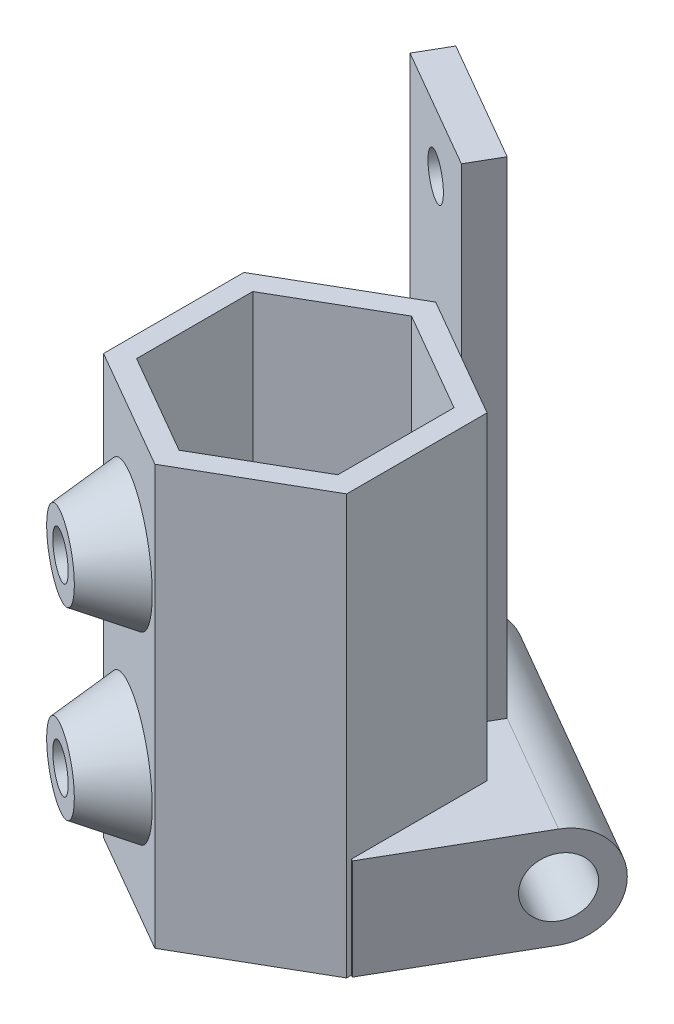
from build123d import *

# Parameters (mm, degrees)
RESSALTO_EXTRUS_O1_DEPTH      = 25
ESBO_O3_R                     = 2.25
RESSALTO_EXTRUS_O2_DEPTH      = 3
ESBO_O6_R                     = 1.25
CORTE_EXTRUS_O2_DEPTH         = 10
RESSALTO_EXTRUS_O3_DEPTH      = 5
RESSALTO_EXTRUS_O3_DEPTH_BACK = 7
ESBO_O8_W                     = 16.743157806
ESBO_O8_H                     = 6
CORTE_EXTRUS_O1_DEPTH         = 32.980788504
FILETE2_R                     = 3
ESBO_O10_R                    = 1.75
CORTE_EXTRUS_O3_DEPTH         = 36.379050234
RESSALTO_EXTRUS_O4_DEPTH      = 29
ESBO_O12_R                    = 1.25
CORTE_EXTRUS_O4_DEPTH         = 41.103846452


with BuildPart() as part:
    # Esboço1 → Ressalto-extrusão1 (new body)
    with BuildSketch(Plane(origin=(0, 0, 0), x_dir=(1, 0, 0), z_dir=(0, 1, 0))):
        Polygon((7.25, 4.185789452), (0, 8.371578903), (-7.25, 4.185789452), (-7.25, -4.185789452), (0, -8.371578903), (7.25, -4.185789452), align=None)
    extrude(amount=RESSALTO_EXTRUS_O1_DEPTH)

    # Esboço3 → Ressalto-extrusão2 (add)
    with BuildSketch(Plane(origin=(-3.625, 0, 6.278684177), x_dir=(0.8660254037844387, 0, 0.4999999999999999), z_dir=(-0.49999999999999994, 0, 0.8660254037844388))):
        with Locations(Location((0, 7, 0), (0, 0, 180))):
            Circle(ESBO_O3_R)
        with Locations(Location((0, 18, 0), (0, 0, 180))):
            Circle(ESBO_O3_R)
    extrude(amount=RESSALTO_EXTRUS_O2_DEPTH)

    # Esboço4 → Revolução1 (revolve)
    with BuildSketch(Plane(origin=(0, 18, 0), x_dir=(1, 0, 0), z_dir=(0, 1, 0))):
        Polygon((-7.073557159, -7.751760389), (-6.872595264, -4.403684177), (-5.573557159, -5.153684177), align=None)
    revolve(axis=Axis((-2.565266445, 18, 4.443171818), (-0.5000000000000001, 0, 0.8660254037844386)))

    # Esboço5 → Revolução2 (revolve)
    with BuildSketch(Plane(origin=(0, 7, 0), x_dir=(-1, 0, 0), z_dir=(0, -1, 0)), mode=Mode.PRIVATE) as revolu_o2_sk:
        Polygon((7.073557159, -7.751760389), (5.573557159, -5.153684177), (6.872595264, -4.403684177), align=None)
    revolve(revolu_o2_sk.sketch.rotate(Axis((-5.573557159, 7, 9.653684177), (0.4999999999999998, 0, -0.8660254037844388)), 180), axis=Axis((-5.573557159, 7, 9.653684177), (0.4999999999999998, 0, -0.8660254037844388)))

    # Esboço6 → Corte-extrusão2 (cut)
    with BuildSketch(Plane(origin=(-5.125, 0, 8.876760389), x_dir=(0.8660254037844386, 0, 0.5), z_dir=(-0.5000000000000001, 0, 0.8660254037844387))):
        with Locations((0, 18)):
            Circle(ESBO_O6_R)
        with Locations(Location((0, 7, 0), (0, 0, 180))):
            Circle(ESBO_O6_R)
    extrude(amount=-CORTE_EXTRUS_O2_DEPTH, mode=Mode.SUBTRACT)

    # Esboço8 → Ressalto-extrusão3 (add, two sides: drawn at the far end of the back side and taken through both)
    with BuildSketch(Plane(origin=(3.625, 0, -6.278684177), x_dir=(-0.8660254037844386, 0, -0.4999999999999999), z_dir=(0.49999999999999994, 0, -0.8660254037844387)).offset(-RESSALTO_EXTRUS_O3_DEPTH_BACK)):
        with Locations((0, 3)):
            Rectangle(ESBO_O8_W, ESBO_O8_H)
    extrude(amount=RESSALTO_EXTRUS_O3_DEPTH + RESSALTO_EXTRUS_O3_DEPTH_BACK)

    # Esboço2 → Corte-extrusão1 (cut, through all)
    with BuildSketch(Plane(origin=(0, 25, 0), x_dir=(1, 0, 0), z_dir=(0, 1, 0))):
        Polygon((0, 6.92820323), (-6, 3.464101615), (-6, -3.464101615), (0, -6.92820323), (6, -3.464101615), (6, 3.464101615), align=None)
    extrude(amount=-CORTE_EXTRUS_O1_DEPTH, mode=Mode.SUBTRACT)

    # Filete2
    filete2_edges = [part.edges().sort_by_distance(p)[0] for p in [
        (6.125, 0, -10.608811196),
        (6.125, 6, -10.608811196),
    ]]
    fillet(filete2_edges, radius=FILETE2_R - 0.0001)  # a hair under: the kernel refuses the full size

    # Esboço10 → Corte-extrusão3 (cut, through all)
    with BuildSketch(Plane(origin=(-7.25, 0, -4.185789452), x_dir=(-0.5000000000000001, 0, 0.8660254037844386), z_dir=(-0.8660254037844386, 0, -0.5000000000000001))):
        with Locations((-9.25, 3)):
            Circle(ESBO_O10_R)
    extrude(amount=-CORTE_EXTRUS_O3_DEPTH, mode=Mode.SUBTRACT)

    # Esboço11 → Ressalto-extrusão4 (add)
    with BuildSketch(Plane(origin=(0, 6, 0), x_dir=(1, 0, 0), z_dir=(0, 1, 0))):
        Polygon((-2.625, 12.196524437), (4.625, 8.010734985), (3.625, 6.278684177), (-3.625, 10.464473629), align=None)
    extrude(amount=RESSALTO_EXTRUS_O4_DEPTH)

    # Esboço12 → Corte-extrusão4 (cut, through all)
    with BuildSketch(Plane(origin=(3.625, 0, -6.278684177), x_dir=(0.8660254037844386, 0, 0.4999999999999999), z_dir=(-0.49999999999999994, 0, 0.8660254037844387))):
        with Locations((-4.185789452, 31.5)):
            Circle(ESBO_O12_R)
    extrude(amount=-CORTE_EXTRUS_O4_DEPTH, mode=Mode.SUBTRACT)


solid = part.part
